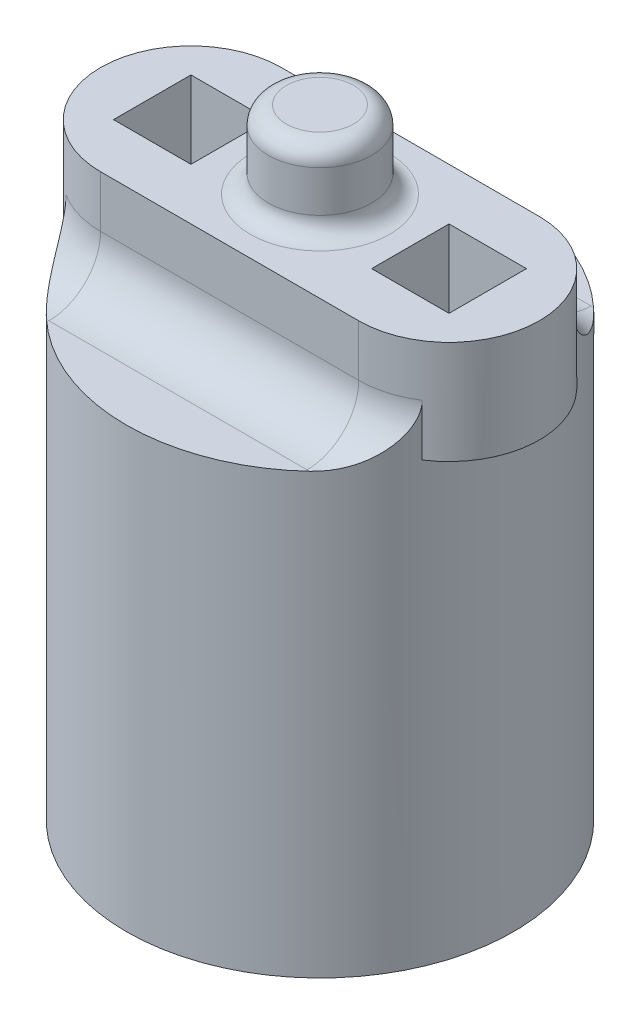
from build123d import *

# Parameters (mm, degrees)
SKETCH1_R           = 7.5
SKETCH1_R_2         = 2.575
BOSS_EXTRUDE1_DEPTH = 15
SKETCH2_R           = 1.25
CUT_EXTRUDE1_DEPTH  = 19.371173071
THREAD1_PITCH       = 0.5
SKETCH12_R          = 7.5
BOSS_EXTRUDE3_DEPTH = 2
SKETCH11_W          = 3
SKETCH11_H          = 3
BOSS_EXTRUDE2_DEPTH = 4
SKETCH13_R          = 2
BOSS_EXTRUDE4_DEPTH = 3
FILLET1_R           = 0.7
FILLET2_R           = 2


with BuildPart() as part:
    # Sketch1 → Boss-Extrude1 (new body)
    with BuildSketch(Plane(origin=(0, 0, 0), x_dir=(1, 0, 0), z_dir=(0, 1, 0))):
        with Locations(Location((0, 0, 0), (0, 0, 270))):
            Circle(SKETCH1_R)
        with Locations(Location((0, 0, 0), (0, 0, 270))):
            Circle(SKETCH1_R_2, mode=Mode.SUBTRACT)
    extrude(amount=BOSS_EXTRUDE1_DEPTH)

    # Sketch2 → Cut-Extrude1 (cut, through all)
    with BuildSketch(Plane.XY):
        with Locations(Location((0, 7.5, 0), (0, 0, 90))):
            Circle(SKETCH2_R)
    extrude(amount=-CUT_EXTRUDE1_DEPTH, mode=Mode.SUBTRACT)

    # Thread1: the profile of Thread Profile1 profile screwed along a right-hand helix of 14 turns, 6 arcs to a turn; built about Z, then put on its axis
    thread1_z = Axis((0, 0, 0), (0, 0, 1))
    thread1_corners = [(1.2497, 0, -0.000173205), (1.520632938, 0, 0.156249999), (1.520632937, 0, 0.218749999), (1.2497, 0, 0.375173204)]
    with BuildLine(mode=Mode.PRIVATE) as thread1_profile:
        Line(thread1_corners[0], thread1_corners[1])
        Line(thread1_corners[1], thread1_corners[2])
        Line(thread1_corners[2], thread1_corners[3])
        Line(thread1_corners[3], thread1_corners[0])
    thread1_cap = Face(thread1_profile.wire())
    thread1_turn_angles = [0, 30, 60, 90, 120, 150, 180, 210, 240, 270, 300, 330, 360]
    thread1_turn_weights = [1, 0.8660254037844387, 1, 0.8660254037844387, 1, 0.8660254037844387, 1, 0.8660254037844387, 1, 0.8660254037844387, 1, 0.8660254037844387, 1]
    thread1_turn_rails = [Edge.make_bspline([Vector(p[0], p[1], 0).rotate(thread1_z, thread1_turn_angles[k]) / thread1_turn_weights[k] + Vector(0, 0, p[2] + THREAD1_PITCH * thread1_turn_angles[k] / 360) for k in range(13)], [0, 0, 0, 1, 1, 2, 2, 3, 3, 4, 4, 5, 5, 6, 6, 6], 2, thread1_turn_weights) for p in thread1_corners]
    thread1_turn_sides = [Face.make_surface_from_curves(thread1_turn_rails[p[0]], thread1_turn_rails[p[1]]) for p in [(0, 1), (1, 2), (2, 3), (3, 0)]]
    thread1 = Plane(origin=(0, 7.5, -8.5), x_dir=(1, 0, 0), z_dir=(0, 0, 1)) * Solid(Shell([*[p.moved(Location((0, 0, THREAD1_PITCH * i))) for i in range(14) for p in thread1_turn_sides], thread1_cap, thread1_cap.rotate(thread1_z, 5040).moved(Location((0, 0, THREAD1_PITCH * 5040 / 360)))]))
    add(thread1, mode=Mode.SUBTRACT)

    # Sketch12 → Boss-Extrude3 (add)
    with BuildSketch(Plane(origin=(0, 15, 0), x_dir=(1, 0, 0), z_dir=(0, 1, 0))):
        with Locations(Location((0, 0, 0), (0, 0, 270))):
            Circle(SKETCH12_R)
    extrude(amount=BOSS_EXTRUDE3_DEPTH)

    # Cut-Extrude2 cone 1 section (through the dimple's axis) → Cut-Extrude2 (revolve, cut)
    with BuildSketch(Plane(origin=(0, 7.5, -7.5), x_dir=(0, 1, 0), z_dir=(1, 0, 0))):
        Polygon((0, 0), (1.75, 0), (0, 1.75), align=None)
    revolve(axis=Axis((0, 7.5, -7.5), (0, 0, 1)), mode=Mode.SUBTRACT)

    # Sketch11 → Boss-Extrude2 (add)
    with BuildSketch(Plane(origin=(0, 17, 0), x_dir=(1, 0, 0), z_dir=(0, 1, 0))):
        with BuildLine():
            Line((-5, 3.5), (5, 3.5))
            ThreePointArc((5, 3.5), (8.5, 0), (5, -3.5))
            Line((5, -3.5), (-5, -3.5))
            ThreePointArc((-5, -3.5), (-8.5, 0), (-5, 3.5))
        make_face()
        with Locations((-5, 0)):
            Rectangle(SKETCH11_W, SKETCH11_H, mode=Mode.SUBTRACT)
        with Locations((5, 0)):
            Rectangle(SKETCH11_W, SKETCH11_H, mode=Mode.SUBTRACT)
    extrude(amount=BOSS_EXTRUDE2_DEPTH)

    # Sketch13 → Boss-Extrude4 (add)
    with BuildSketch(Plane(origin=(0, 21, 0), x_dir=(1, 0, 0), z_dir=(0, 1, 0))):
        with Locations(Location((0, 0, 0), (0, 0, 270))):
            Circle(SKETCH13_R)
    extrude(amount=BOSS_EXTRUDE4_DEPTH)

    # Fillet1
    fillet1_edges = [part.edges().sort_by_distance(p)[0] for p in [
        (0, 21, -2),
        (0, 24, -2),
    ]]
    fillet(fillet1_edges, radius=FILLET1_R)

    # Fillet2
    # the kernel refuses this fillet: 2 mm, written as the material it adds along each edge
    with BuildSketch(Plane(origin=(-5, 17, 0), x_dir=(-0.9082611447575626, 0, 0.41840374391690366), z_dir=(0.41840374391690366, 0, 0.9082611447575626))) as fillet2_piece_1_section:
        with BuildLine():
            CenterArc((3.5 + FILLET2_R, -FILLET2_R), FILLET2_R, 90, 90)
            Line((3.5 + FILLET2_R, 0), (3.5, 0))
            Line((3.5, 0), (3.5, -FILLET2_R))
        make_face()
    fillet2_piece_1 = revolve(axis=Axis((-5, 17, 0), (0, -1, 0)), revolution_arc=114.733850122, mode=Mode.PRIVATE)
    fillet2_piece_1 = fillet2_piece_1 & Plane(origin=(0, 17.722012211, 0), x_dir=(0, 0, 1), z_dir=(0, -1, 0)) * Cylinder(7.5, 22, mode=Mode.PRIVATE)
    add(fillet2_piece_1)
    with BuildSketch(Plane(origin=(5, 17, 3.5), x_dir=(0, 1, 0), z_dir=(-1, 0, 0)), Plane(origin=(-5, 17, -3.5), x_dir=(0, 1, 0), z_dir=(1, 0, 0))) as fillet2_piece_2:
        with BuildLine():
            CenterArc((FILLET2_R, -FILLET2_R), FILLET2_R, 90, 90)
            Line((0, -FILLET2_R), (0, 0))
            Line((0, 0), (FILLET2_R, 0))
        make_face()
    extrude(amount=10)
    with BuildSketch(Plane(origin=(5, 17, 0), x_dir=(0.9082611447575616, 0, -0.4184037439169059), z_dir=(-0.4184037439169059, 0, -0.9082611447575616))) as fillet2_piece_3_section:
        with BuildLine():
            CenterArc((3.5 + FILLET2_R, -FILLET2_R), FILLET2_R, 90, 90)
            Line((3.5 + FILLET2_R, 0), (3.5, 0))
            Line((3.5, 0), (3.5, -FILLET2_R))
        make_face()
    fillet2_piece_3 = revolve(axis=Axis((5, 17, 0), (0, -1, 0)), revolution_arc=114.733850122, mode=Mode.PRIVATE)
    fillet2_piece_3 = fillet2_piece_3 & Plane(origin=(0, 17.722012211, 0), x_dir=(0, 0, 1), z_dir=(0, -1, 0)) * Cylinder(7.5, 22, mode=Mode.PRIVATE)
    add(fillet2_piece_3)
    with BuildSketch(Plane(origin=(-5, 17, 0), x_dir=(0, 0, 1), z_dir=(1, 0, 0))) as fillet2_piece_4_section:
        with BuildLine():
            CenterArc((3.5 + FILLET2_R, -FILLET2_R), FILLET2_R, 90, 90)
            Line((3.5 + FILLET2_R, 0), (3.5, 0))
            Line((3.5, 0), (3.5, -FILLET2_R))
        make_face()
    fillet2_piece_4 = revolve(axis=Axis((-5, 17, 0), (0, -1, 0)), revolution_arc=114.733850122, mode=Mode.PRIVATE)
    fillet2_piece_4 = fillet2_piece_4 & Plane(origin=(0, 17.722012144, 0), x_dir=(0, 0, 1), z_dir=(0, -1, 0)) * Cylinder(7.5, 22, mode=Mode.PRIVATE)
    add(fillet2_piece_4)
    with BuildSketch(Plane(origin=(5, 17, 0), x_dir=(0, 0, -1), z_dir=(-1, 0, 0))) as fillet2_piece_5_section:
        with BuildLine():
            CenterArc((3.5 + FILLET2_R, -FILLET2_R), FILLET2_R, 90, 90)
            Line((3.5 + FILLET2_R, 0), (3.5, 0))
            Line((3.5, 0), (3.5, -FILLET2_R))
        make_face()
    fillet2_piece_5 = revolve(axis=Axis((5, 17, 0), (0, -1, 0)), revolution_arc=114.733850122, mode=Mode.PRIVATE)
    fillet2_piece_5 = fillet2_piece_5 & Plane(origin=(0, 17.722012144, 0), x_dir=(0, 0, 1), z_dir=(0, -1, 0)) * Cylinder(7.5, 22, mode=Mode.PRIVATE)
    add(fillet2_piece_5)


solid = part.part
